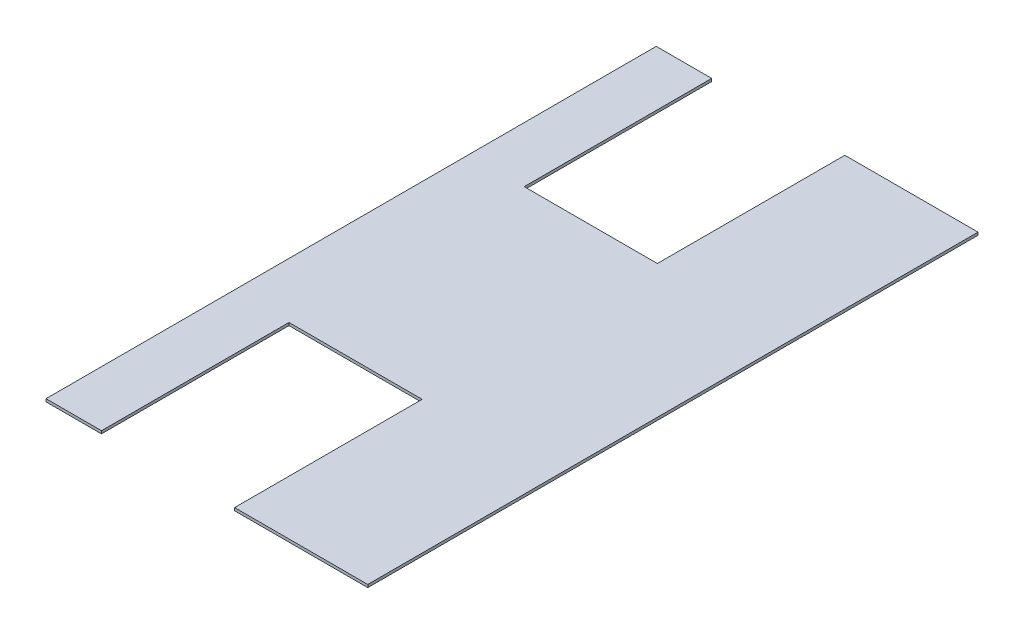
from build123d import *

# Parameters (mm, degrees)
BOSS_EXTRUDE1_DEPTH = 3.175


with BuildPart() as part:
    # Sketch1 → Boss-Extrude1 (new body)
    with BuildSketch(Plane(origin=(0, 0, 0), x_dir=(1, 0, 0), z_dir=(0, 1, 0))):
        Polygon((-195.965852537, 446.32626), (-43.565852537, 446.32626), (-43.565852537, -252.17374), (-195.965852537, -252.17374), (-195.965852537, -37.54374), (-348.365852537, -37.54374), (-348.365852537, -252.17374), (-411.865852537, -252.17374), (-411.865852537, 446.32626), (-348.365852537, 446.32626), (-348.365852537, 231.69626), (-195.965852537, 231.69626), align=None)
    extrude(amount=BOSS_EXTRUDE1_DEPTH)


solid = part.part
